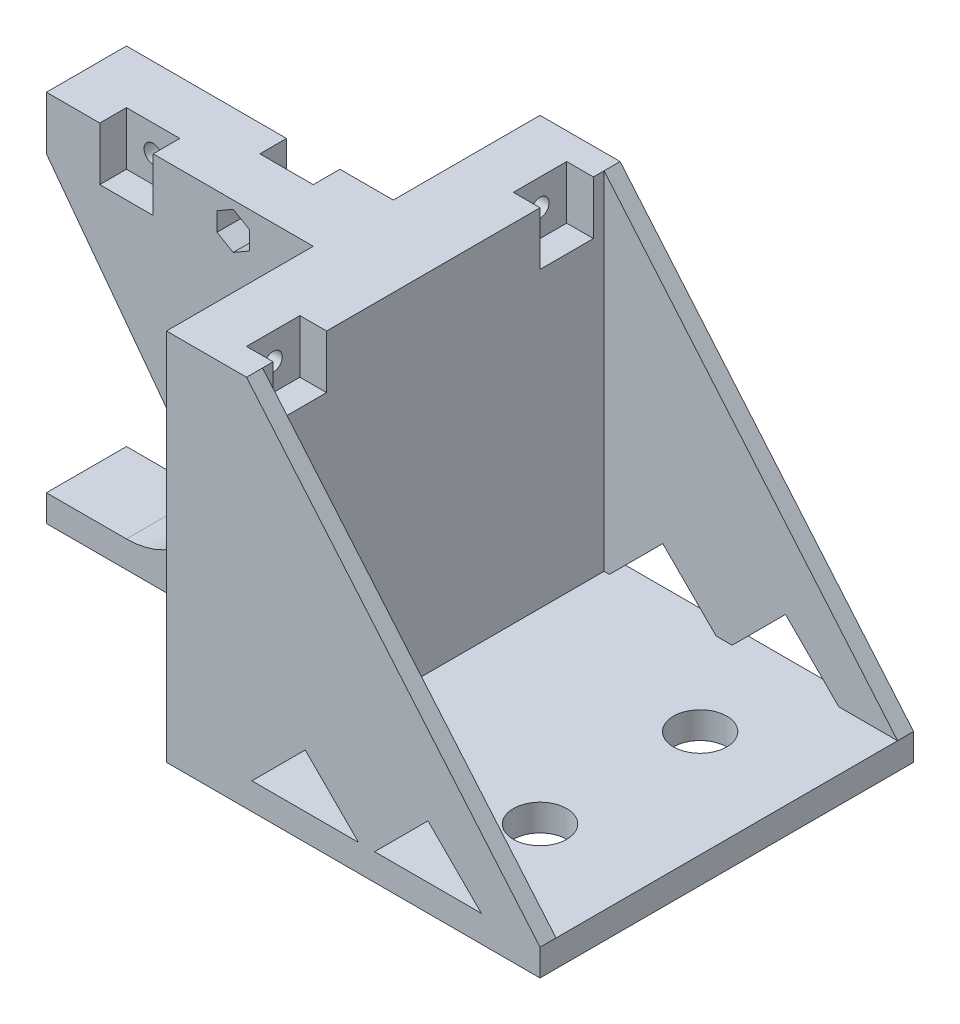
from build123d import *

# Parameters (mm, degrees)
SKETCH1_R           = 5
BOSS_EXTRUDE1_DEPTH = 5
BOSS_EXTRUDE2_DEPTH = 65
SKETCH3_W           = 15
SKETCH3_H           = 10
BOSS_EXTRUDE3_DEPTH = 30
CHAMFER2_SIZE2      = 40
CHAMFER2_SIZE       = 30
SKETCH4_W           = 10
SKETCH4_H           = 5
SKETCH4_W_2         = 5
SKETCH4_H_2         = 10
CUT_EXTRUDE1_DEPTH  = 10
CUT_EXTRUDE2_START  = -5
CUT_EXTRUDE2_DEPTH  = 10
SKETCH6_R           = 1.7
CUT_EXTRUDE3_DEPTH  = 10
SKETCH7_R           = 1.7
CUT_EXTRUDE4_DEPTH  = 10
CUT_EXTRUDE5_START  = -5
CUT_EXTRUDE5_DEPTH  = 10
SKETCH9_R           = 1.7
CUT_EXTRUDE6_DEPTH  = 10
CUT_EXTRUDE7_START  = -5
CUT_EXTRUDE7_DEPTH  = 10
FILLET2_R           = 15
BOSS_EXTRUDE4_DEPTH = 3


with BuildPart() as part:
    # Sketch1 → Boss-Extrude1 (new body)
    with BuildSketch(Plane(origin=(0, 0, 0), x_dir=(1, 0, 0), z_dir=(0, 1, 0))):
        Polygon((60, -35), (60, 35), (-10, 35), (-10, 7.5), (-60, 7.5), (-60, -7.5), (-10, -7.5), (-10, -35), align=None)
        with Locations(Location((40, 15, 0), (0, 0, 270))):
            Circle(SKETCH1_R, mode=Mode.SUBTRACT)
        with Locations(Location((40, -15, 0), (0, 0, 270))):
            Circle(SKETCH1_R, mode=Mode.SUBTRACT)
    extrude(amount=BOSS_EXTRUDE1_DEPTH)

    # Sketch2 → Boss-Extrude2 (add)
    with BuildSketch(Plane(origin=(0, 5, 0), x_dir=(1, 0, 0), z_dir=(0, 1, 0))):
        Polygon((-10, 35), (-10, 7.5), (-30, 7.5), (-30, -7.5), (-10, -7.5), (-10, -35), (5, -35), (5, 35), align=None)
    extrude(amount=BOSS_EXTRUDE2_DEPTH)

    # Sketch3 → Boss-Extrude3 (add)
    with BuildSketch(Plane.ZY.offset(30)):
        with Locations((0, 65)):
            Rectangle(SKETCH3_W, SKETCH3_H)
    extrude(amount=BOSS_EXTRUDE3_DEPTH)

    # Chamfer2
    chamfer2_edges = [part.edges().sort_by_distance(p)[0] for p in [
        (-30, 60, 0),
    ]]
    chamfer2_side = [part.faces().sort_by_distance(p)[0] for p in [
        (-30.6, 60, 0),
    ]]
    chamfer(chamfer2_edges, length=CHAMFER2_SIZE - 0.0001, length2=CHAMFER2_SIZE2 - 0.0001, reference=chamfer2_side[0])  # a hair under: the kernel refuses the full size

    # Sketch4 → Cut-Extrude1 (cut)
    with BuildSketch(Plane(origin=(0, 70, 0), x_dir=(1, 0, 0), z_dir=(0, 1, 0))):
        with Locations((-25, 5)):
            Rectangle(SKETCH4_W, SKETCH4_H)
        with Locations((-45, -5)):
            Rectangle(SKETCH4_W, SKETCH4_H)
        with Locations((2.5, 25)):
            Rectangle(SKETCH4_W_2, SKETCH4_H_2)
        with Locations((2.5, -25)):
            Rectangle(SKETCH4_W_2, SKETCH4_H_2)
    extrude(amount=-CUT_EXTRUDE1_DEPTH, mode=Mode.SUBTRACT)

    # Sketch5 → Cut-Extrude2 (cut)
    with BuildSketch(Plane(origin=(0, 0, 0), x_dir=(0, 0, -1), z_dir=(1, 0, 0)).offset(CUT_EXTRUDE2_START)):
        Polygon((-25, 61.5), (-21.968911087, 63.25), (-21.968911087, 66.75), (-25, 68.5), (-28.031088913, 66.75), (-28.031088913, 63.25), align=None)
    cut_extrude2 = extrude(amount=-CUT_EXTRUDE2_DEPTH, mode=Mode.SUBTRACT)

    # Sketch6 → Cut-Extrude3 (cut)
    with BuildSketch(Plane(origin=(0, 0, 0), x_dir=(0, 0, -1), z_dir=(1, 0, 0))):
        with Locations((-25, 65)):
            Circle(SKETCH6_R)
    cut_extrude3 = extrude(amount=-CUT_EXTRUDE3_DEPTH, mode=Mode.SUBTRACT)

    # Mirror1: Cut-Extrude2 across plane
    add(cut_extrude2.mirror(Plane.XY), mode=Mode.SUBTRACT)

    # Mirror2: Cut-Extrude3 across plane
    add(cut_extrude3.mirror(Plane.XY), mode=Mode.SUBTRACT)

    # Sketch7 → Cut-Extrude4 (cut)
    with BuildSketch(Plane.XY.offset(2.5)):
        with Locations((-45, 65)):
            Circle(SKETCH7_R)
    extrude(amount=-CUT_EXTRUDE4_DEPTH, mode=Mode.SUBTRACT)

    # Sketch8 → Cut-Extrude5 (cut)
    with BuildSketch(Plane.XY.offset(2.5).offset(CUT_EXTRUDE5_START)):
        Polygon((-45, 68.5), (-48.031088913, 66.75), (-48.031088913, 63.25), (-45, 61.5), (-41.968911087, 63.25), (-41.968911087, 66.75), align=None)
    extrude(amount=-CUT_EXTRUDE5_DEPTH, mode=Mode.SUBTRACT)

    # Sketch9 → Cut-Extrude6 (cut)
    with BuildSketch(Plane(origin=(0, 0, -2.5), x_dir=(-1, 0, 0), z_dir=(0, 0, -1))):
        with Locations((25, 65)):
            Circle(SKETCH9_R)
    extrude(amount=-CUT_EXTRUDE6_DEPTH, mode=Mode.SUBTRACT)

    # Sketch10 → Cut-Extrude7 (cut)
    with BuildSketch(Plane(origin=(0, 0, -2.5), x_dir=(-1, 0, 0), z_dir=(0, 0, -1)).offset(CUT_EXTRUDE7_START)):
        Polygon((25, 68.5), (21.968911087, 66.75), (21.968911087, 63.25), (25, 61.5), (28.031088913, 63.25), (28.031088913, 66.75), align=None)
    extrude(amount=-CUT_EXTRUDE7_DEPTH, mode=Mode.SUBTRACT)

    # Fillet2
    fillet2_edges = [part.edges().sort_by_distance(p)[0] for p in [
        (-30, 5, 0),
    ]]
    fillet(fillet2_edges, radius=FILLET2_R)

    # Sketch11 → Boss-Extrude4 (add)
    with BuildSketch(Plane(origin=(0, 0, -35), x_dir=(-1, 0, 0), z_dir=(0, 0, -1))):
        Polygon((-5, 70), (-60, 5), (-49, 5), (-39, 15), (-29, 5), (-26, 5), (-16, 15), (-6, 5), (-5, 5), align=None)
    boss_extrude4 = extrude(amount=-BOSS_EXTRUDE4_DEPTH)

    # Mirror3: Boss-Extrude4 across plane
    add(boss_extrude4.mirror(Plane.XY))


solid = part.part
